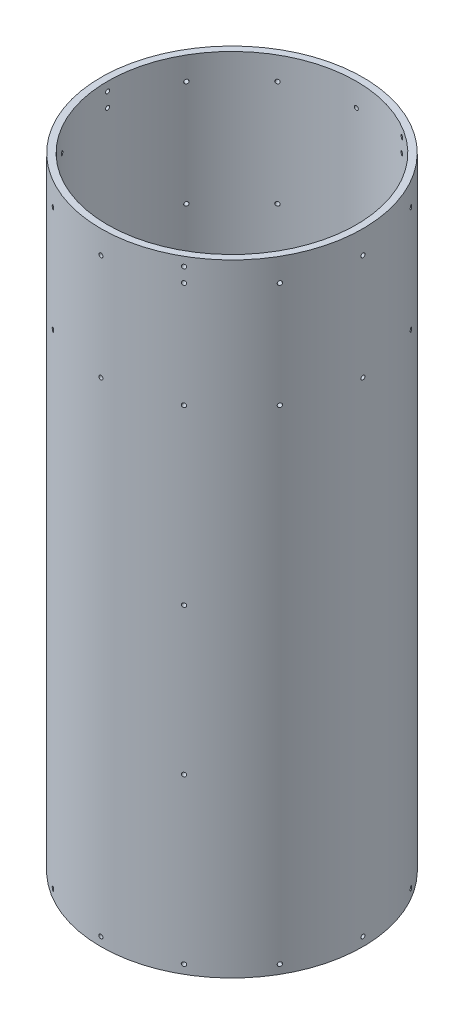
from build123d import *

# Parameters (mm, degrees)
SKETCH1_R           = 93.6625
SKETCH1_R_2         = 88.9
BOSS_EXTRUDE1_DEPTH = 222.25
SKETCH3_R           = 1.4351
CUT_EXTRUDE1_DEPTH  = 21.59
CIRPATTERN1_COUNT   = 12
SKETCH4_R           = 1.4351
CUT_EXTRUDE2_DEPTH  = 34.798
CIRPATTERN2_COUNT   = 3
SKETCH9_R           = 1.4351
CUT_EXTRUDE4_DEPTH  = 15.24
CIRPATTERN4_COUNT   = 12
SKETCH7_R           = 1.4351
CUT_EXTRUDE3_DEPTH  = 15.24
CIRPATTERN3_COUNT   = 3
SKETCH10_R          = 1.4351
CUT_EXTRUDE5_DEPTH  = 21.082
CIRPATTERN5_COUNT   = 12


with BuildPart() as part:
    # Sketch1 → Boss-Extrude1 (new, symmetric)
    with BuildSketch(Plane(origin=(0, 0, 0), x_dir=(1, 0, 0), z_dir=(0, 1, 0))):
        Circle(SKETCH1_R)
        Circle(SKETCH1_R_2, mode=Mode.SUBTRACT)
    extrude(amount=BOSS_EXTRUDE1_DEPTH, both=True)

    # Sketch3 → Cut-Extrude1 (cut)
    with BuildSketch(Plane.ZY.offset(93.6625)):
        with Locations((0, -215.9)):
            Circle(SKETCH3_R)
    cut_extrude1 = extrude(amount=-CUT_EXTRUDE1_DEPTH, mode=Mode.SUBTRACT)

    # CirPattern1: Cut-Extrude1 ×12 about axis
    cirpattern1_axis = Axis((0, 222.25, 0), (0, -1, 0))
    for i in range(1, CIRPATTERN1_COUNT):
        add(cut_extrude1.rotate(cirpattern1_axis, i * 360 / CIRPATTERN1_COUNT), mode=Mode.SUBTRACT)

    # Sketch4 → Cut-Extrude2 (cut)
    with BuildSketch(Plane.ZY.offset(93.6625)):
        with Locations((0, 215.9)):
            Circle(SKETCH4_R)
    cut_extrude2 = extrude(amount=-CUT_EXTRUDE2_DEPTH, mode=Mode.SUBTRACT)

    # CirPattern2: Cut-Extrude2 ×3 about axis
    cirpattern2_axis = Axis((0, 222.25, 0), (0, -1, 0))
    for i in range(1, CIRPATTERN2_COUNT):
        add(cut_extrude2.rotate(cirpattern2_axis, i * 360 / CIRPATTERN2_COUNT), mode=Mode.SUBTRACT)

    # Sketch9 → Cut-Extrude4 (cut)
    with BuildSketch(Plane.ZY.offset(93.6625)):
        with Locations((0, 130.048)):
            Circle(SKETCH9_R)
    cut_extrude4 = extrude(amount=-CUT_EXTRUDE4_DEPTH, mode=Mode.SUBTRACT)

    # CirPattern4: Cut-Extrude4 ×12 about axis
    cirpattern4_axis = Axis((0, 222.25, 0), (0, -1, 0))
    for i in range(1, CIRPATTERN4_COUNT):
        add(cut_extrude4.rotate(cirpattern4_axis, i * 360 / CIRPATTERN4_COUNT), mode=Mode.SUBTRACT)

    # Sketch7 → Cut-Extrude3 (cut)
    with BuildSketch(Plane.ZY.offset(93.6625)):
        with Locations((0, 6.35)):
            Circle(SKETCH7_R)
        with Locations((0, -98.552)):
            Circle(SKETCH7_R)
    cut_extrude3 = extrude(amount=-CUT_EXTRUDE3_DEPTH, mode=Mode.SUBTRACT)

    # CirPattern3: Cut-Extrude3 ×3 about axis
    cirpattern3_axis = Axis((0, 222.25, 0), (0, -1, 0))
    for i in range(1, CIRPATTERN3_COUNT):
        add(cut_extrude3.rotate(cirpattern3_axis, i * 360 / CIRPATTERN3_COUNT), mode=Mode.SUBTRACT)

    # Sketch10 → Cut-Extrude5 (cut)
    with BuildSketch(Plane.ZY.offset(93.6625)):
        with Locations((0, 205.74)):
            Circle(SKETCH10_R)
    cut_extrude5 = extrude(amount=-CUT_EXTRUDE5_DEPTH, mode=Mode.SUBTRACT)

    # CirPattern5: Cut-Extrude5 ×12 about axis
    cirpattern5_axis = Axis((0, 222.25, 0), (0, -1, 0))
    for i in range(1, CIRPATTERN5_COUNT):
        add(cut_extrude5.rotate(cirpattern5_axis, i * 360 / CIRPATTERN5_COUNT), mode=Mode.SUBTRACT)


solid = part.part
